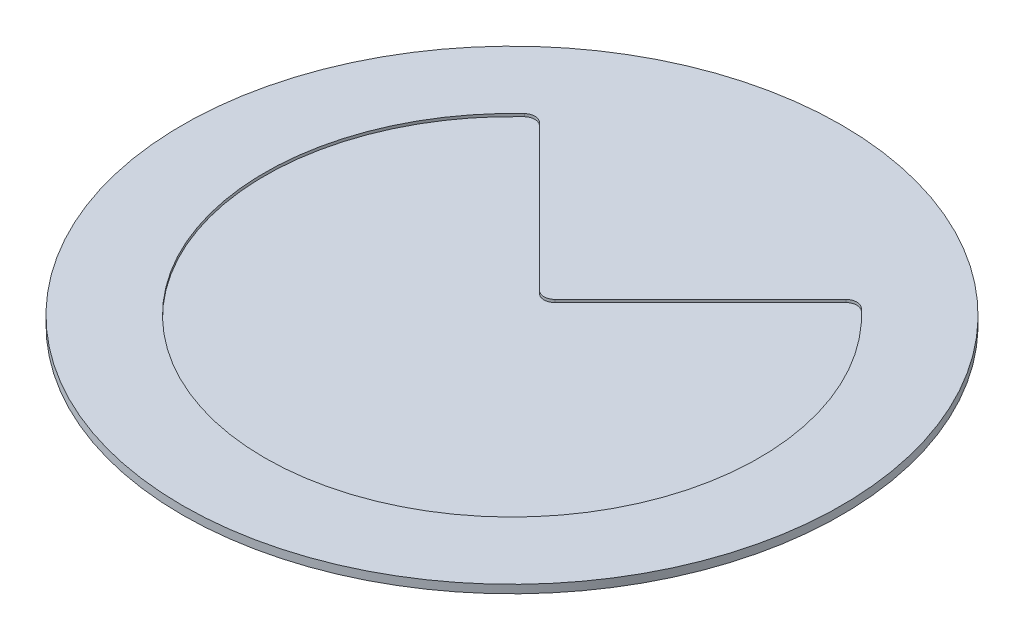
from build123d import *

# Parameters (mm, degrees)
SKETCH1_R           = 60
BOSS_EXTRUDE1_DEPTH = 0.5
FILLET1_R           = 2
BOSS_EXTRUDE2_START = 1
SKETCH2_R           = 60
BOSS_EXTRUDE2_DEPTH = 1


with BuildPart() as part:
    # Sketch1 → Boss-Extrude1 (new body)
    with BuildSketch(Plane(origin=(0, 0, 0), x_dir=(1, 0, 0), z_dir=(0, 1, 0))):
        Circle(SKETCH1_R)
        with BuildLine():
            Line((-29.221443851, 34.221443851), (0, 5))
            Line((0, 5), (29.221443851, 34.221443851))
            ThreePointArc((29.221443851, 34.221443851), (0, -45), (-29.221443851, 34.221443851))
        make_face(mode=Mode.SUBTRACT)
    extrude(amount=BOSS_EXTRUDE1_DEPTH)

    # Fillet1
    fillet1_edges = [part.edges().sort_by_distance(p)[0] for p in [
        (-29.221443851, 0.25, -34.221443851),
        (29.221443851, 0.25, -34.221443851),
        (0, 0.25, -5),
    ]]
    fillet(fillet1_edges, radius=FILLET1_R)

    # Sketch2 → Boss-Extrude2 (add)
    with BuildSketch(Plane.XZ.offset(BOSS_EXTRUDE2_START)):
        Circle(SKETCH2_R)
    extrude(amount=-BOSS_EXTRUDE2_DEPTH)


solid = part.part
